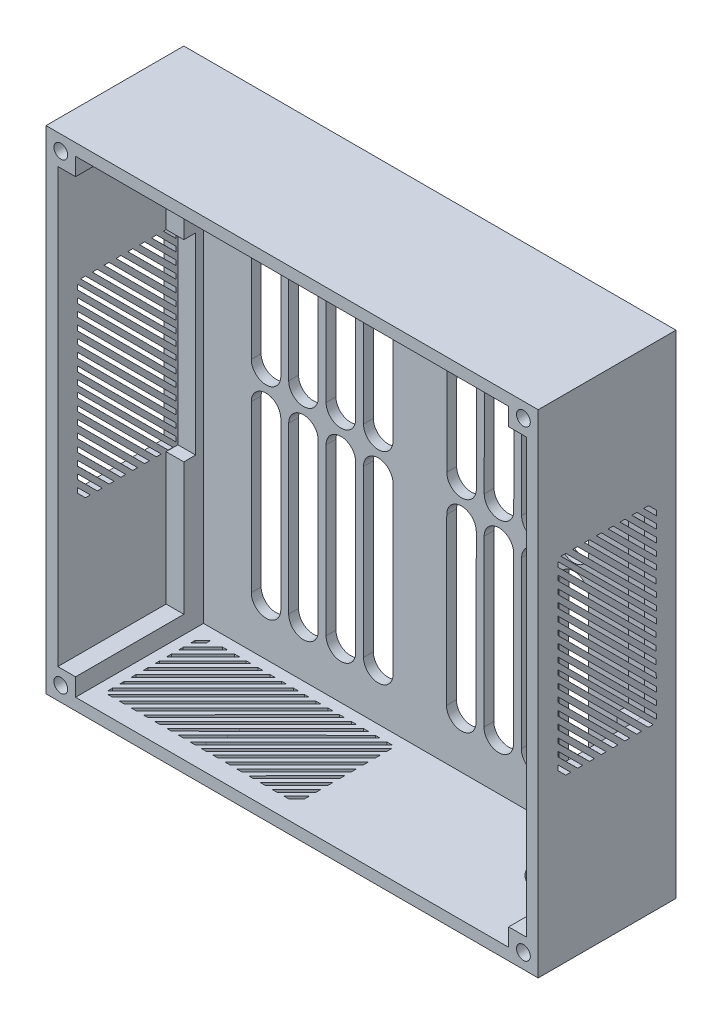
from build123d import *

# Parameters (mm, degrees)
ESBO_O1_W                = 250
ESBO_O1_H                = 250
RESSALTO_EXTRUS_O1_DEPTH = 70
ESBO_O2_W                = 238
ESBO_O2_H                = 238
CORTE_EXTRUS_O1_DEPTH    = 55
CORTE_EXTRUS_O2_DEPTH    = 340.168183978
ESBO_O7_W                = 220
ESBO_O7_H                = 229
CORTE_EXTRUS_O3_DEPTH    = 10
CORTE_EXTRUS_O4_DEPTH    = 284
CORTE_EXTRUS_O5_DEPTH    = 6
ESBO_O10_W               = 9
ESBO_O10_H               = 9
RESSALTO_EXTRUS_O2_DEPTH = 55
ESBO_O11_R               = 3.5
CORTE_EXTRUS_O6_DEPTH    = 25
ESBO_O12_R               = 13.5
CORTE_EXTRUS_O7_DEPTH    = 10


with BuildPart() as part:
    # Esboço1 → Ressalto-extrusão1 (new body)
    with BuildSketch(Plane.XY):
        with Locations((108.430425713, 114.833887043)):
            Rectangle(ESBO_O1_W, ESBO_O1_H)
    extrude(amount=RESSALTO_EXTRUS_O1_DEPTH)

    # Esboço2 → Corte-extrusão1 (cut)
    with BuildSketch(Plane.XY.offset(70)):
        with Locations((108.430425713, 114.833887043)):
            Rectangle(ESBO_O2_W, ESBO_O2_H)
    extrude(amount=-CORTE_EXTRUS_O1_DEPTH, mode=Mode.SUBTRACT)

    # Esboço6 → Corte-extrusão2 (cut, through all)
    with BuildSketch(Plane.XY.offset(15)):
        with BuildLine():
            Line((22.695507498, 208.167609342), (22.695507498, 124.153986831))
            ThreePointArc((22.695507498, 124.153986831), (30.195507498, 116.653986831), (37.695507498, 124.153986831))
            Line((37.695507498, 124.153986831), (37.695507498, 208.167609342))
            ThreePointArc((37.695507498, 208.167609342), (30.195507498, 215.667609342), (22.695507498, 208.167609342))
        make_face()
        with BuildLine():
            Line((41.695507498, 208.167609342), (41.695507498, 124.153986831))
            ThreePointArc((41.695507498, 124.153986831), (49.195507498, 116.653986831), (56.695507498, 124.153986831))
            Line((56.695507498, 124.153986831), (56.695507498, 208.167609342))
            ThreePointArc((56.695507498, 208.167609342), (49.195507498, 215.667609342), (41.695507498, 208.167609342))
        make_face()
        with BuildLine():
            Line((60.695507498, 208.167609342), (60.695507498, 124.153986831))
            ThreePointArc((60.695507498, 124.153986831), (68.195507498, 116.653986831), (75.695507498, 124.153986831))
            Line((75.695507498, 124.153986831), (75.695507498, 208.167609342))
            ThreePointArc((75.695507498, 208.167609342), (68.195507498, 215.667609342), (60.695507498, 208.167609342))
        make_face()
        with BuildLine():
            Line((79.695507498, 208.167609342), (79.695507498, 124.153986831))
            ThreePointArc((79.695507498, 124.153986831), (87.195507498, 116.653986831), (94.695507498, 124.153986831))
            Line((94.695507498, 124.153986831), (94.695507498, 208.167609342))
            ThreePointArc((94.695507498, 208.167609342), (87.195507498, 215.667609342), (79.695507498, 208.167609342))
        make_face()
        with BuildLine():
            Line((94.695507498, 105.513787255), (94.695507498, 21.500164744))
            ThreePointArc((94.695507498, 21.500164744), (87.195507498, 14.000164744), (79.695507498, 21.500164744))
            Line((79.695507498, 21.500164744), (79.695507498, 105.513787255))
            ThreePointArc((79.695507498, 105.513787255), (87.195507498, 113.013787255), (94.695507498, 105.513787255))
        make_face()
        with BuildLine():
            Line((75.695507498, 105.513787255), (75.695507498, 21.500164744))
            ThreePointArc((75.695507498, 21.500164744), (68.195507498, 14.000164744), (60.695507498, 21.500164744))
            Line((60.695507498, 21.500164744), (60.695507498, 105.513787255))
            ThreePointArc((60.695507498, 105.513787255), (68.195507498, 113.013787255), (75.695507498, 105.513787255))
        make_face()
        with BuildLine():
            Line((56.695507498, 105.513787256), (56.695507498, 21.500164744))
            ThreePointArc((56.695507498, 21.500164744), (49.195507498, 14.000164744), (41.695507498, 21.500164744))
            Line((41.695507498, 21.500164744), (41.695507498, 105.513787256))
            ThreePointArc((41.695507498, 105.513787256), (49.195507498, 113.013787256), (56.695507498, 105.513787256))
        make_face()
        with BuildLine():
            Line((37.695507498, 21.500164744), (37.695507498, 105.513787256))
            ThreePointArc((37.695507498, 105.513787256), (30.195507498, 113.013787256), (22.695507498, 105.513787256))
            Line((22.695507498, 105.513787256), (22.695507498, 21.500164744))
            ThreePointArc((22.695507498, 21.500164744), (30.195507498, 14.000164744), (37.695507498, 21.500164744))
        make_face()
        with BuildLine():
            Line((193.875104062, 21.383203899), (193.989910965, 105.396747967))
            ThreePointArc((193.989910965, 105.396747967), (186.500166922, 112.906989919), (178.989924971, 105.417245876))
            Line((178.989924971, 105.417245876), (178.875118068, 21.403701808))
            ThreePointArc((178.875118068, 21.403701808), (186.36486211, 13.893459856), (193.875104062, 21.383203899))
        make_face()
        with BuildLine():
            Line((174.875121802, 21.409167917), (174.989928706, 105.422711985))
            ThreePointArc((174.989928706, 105.422711985), (167.500184663, 112.932953936), (159.989942711, 105.443209893))
            Line((159.989942711, 105.443209893), (159.875135808, 21.429665825))
            ThreePointArc((159.875135808, 21.429665825), (167.364879851, 13.919423874), (174.875121802, 21.409167917))
        make_face()
        with BuildLine():
            Line((155.875139543, 21.435131934), (155.989946446, 105.448676002))
            ThreePointArc((155.989946446, 105.448676002), (148.500202403, 112.958917953), (140.989960451, 105.46917391))
            Line((140.989960451, 105.46917391), (140.875153548, 21.455629843))
            ThreePointArc((140.875153548, 21.455629843), (148.364897591, 13.945387891), (155.875139543, 21.435131934))
        make_face()
        with BuildLine():
            Line((136.875157283, 21.461095951), (136.989964186, 105.474640019))
            ThreePointArc((136.989964186, 105.474640019), (129.500220143, 112.984881971), (121.989978192, 105.495137928))
            Line((121.989978192, 105.495137928), (121.875171288, 21.48159386))
            ThreePointArc((121.875171288, 21.48159386), (129.364915331, 13.971351908), (136.875157283, 21.461095951))
        make_face()
        with BuildLine():
            Line((122.015450532, 124.135320099), (122.130257436, 208.148864167))
            ThreePointArc((122.130257436, 208.148864167), (129.640499387, 215.63860821), (137.13024343, 208.128366259))
            Line((137.13024343, 208.128366259), (137.015436527, 124.114822191))
            ThreePointArc((137.015436527, 124.114822191), (129.505194575, 116.625078148), (122.015450532, 124.135320099))
        make_face()
        with BuildLine():
            Line((141.015432792, 124.109356082), (141.130239695, 208.122900149))
            ThreePointArc((141.130239695, 208.122900149), (148.640481647, 215.612644192), (156.13022569, 208.102402241))
            Line((156.13022569, 208.102402241), (156.015418786, 124.088858173))
            ThreePointArc((156.015418786, 124.088858173), (148.505176835, 116.59911413), (141.015432792, 124.109356082))
        make_face()
        with BuildLine():
            Line((160.015415052, 124.083392064), (160.130221955, 208.096936132))
            ThreePointArc((160.130221955, 208.096936132), (167.640463907, 215.586680175), (175.13020795, 208.076438223))
            Line((175.13020795, 208.076438223), (175.015401046, 124.062894155))
            ThreePointArc((175.015401046, 124.062894155), (167.505159095, 116.573150112), (160.015415052, 124.083392064))
        make_face()
        with BuildLine():
            Line((179.130204215, 208.070972114), (179.015397311, 124.057428046))
            ThreePointArc((179.015397311, 124.057428046), (186.505141354, 116.547186095), (194.015383306, 124.036930138))
            Line((194.015383306, 124.036930138), (194.130190209, 208.050474206))
            ThreePointArc((194.130190209, 208.050474206), (186.640446166, 215.560716157), (179.130204215, 208.070972114))
        make_face()
    extrude(amount=-CORTE_EXTRUS_O2_DEPTH, mode=Mode.SUBTRACT)

    # Esboço7 → Corte-extrusão3 (cut)
    with BuildSketch(Plane.XY.offset(15)):
        with Locations((108.430425713, 110.333887043)):
            Rectangle(ESBO_O7_W, ESBO_O7_H)
    extrude(amount=-CORTE_EXTRUS_O3_DEPTH, mode=Mode.SUBTRACT)

    # Esboço8 → Corte-extrusão4 (cut)
    with BuildSketch(Plane.ZY.offset(16.569574287)):
        Polygon((10, 165.657391929), (13.961640311, 169.619032239), (16.461640311, 169.619032239), (10, 163.157391929), align=None)
        Polygon((9.956696651, 159.702229933), (19.862081873, 169.619032239), (22.461640311, 169.619032239), (9.958136588, 157.202230348), align=None)
        Polygon((9.966328348, 153.687514394), (25.894980213, 169.619032239), (28.461640311, 169.619032239), (9.966553235, 151.187514404), align=None)
        Polygon((9.968480298, 147.691590035), (31.898716024, 169.619032239), (34.461640311, 169.619032239), (9.96832106, 145.19159004), align=None)
        Polygon((9.969979722, 141.689354591), (37.916440288, 169.619032239), (40.461640311, 169.619032239), (9.969228824, 139.189354704), align=None)
        Polygon((10.043084045, 135.657583442), (43.961640311, 169.619032239), (46.504532842, 169.619032239), (10.043084045, 133.157583442), align=None)
        Polygon((10.000315774, 129.657707703), (50.008285442, 169.619032239), (52.511524518, 169.619032239), (10.000315774, 127.157707703), align=None)
        Polygon((9.975901213, 123.689230729), (55.961640311, 169.619032239), (58.461640311, 169.619032239), (9.974420071, 121.189231168), align=None)
        Polygon((60.01635331, 168.062475947), (60.013391026, 165.562477702), (14.029132631, 119.629929589), (10, 115.605352624), (10, 118.105352624), (11.52913307, 119.632674875), align=None)
        Polygon((60.009302937, 162.112364331), (60.006336815, 159.609127013), (22.55626101, 122.084448938), (10.040407278, 109.546632677), (10.043104787, 112.046631221), (20.063650654, 122.087138476), align=None)
        Polygon((60.002185171, 156.105376873), (59.999172063, 153.562486126), (28.495336324, 122.078040649), (10.033931215, 103.544745925), (10.036628725, 106.04474447), (25.95663356, 122.08077992), align=None)
        Polygon((59.995024865, 150.062488583), (59.992009023, 147.517290347), (34.535969381, 122.071522778), (10.027487599, 97.57293071), (10.030152907, 100.043085143), (31.998054458, 122.0742612), align=None)
        Polygon((59.987915383, 144.062492795), (59.98487854, 141.499570308), (40.533783745, 122.06505111), (10.021019354, 91.578288714), (10.023677595, 94.041893995), (38.003614648, 122.067781174), align=None)
        Polygon((59.980805902, 138.062497008), (59.977764631, 135.495838711), (46.52552807, 122.058585991), (10.014556109, 85.588281957), (10.017208432, 88.046402315), (44.00304904, 122.061307757), align=None)
        Polygon((59.97369642, 132.06250122), (59.970616168, 129.462944607), (52.545171852, 122.052090768), (10.00809321, 79.598594503), (10.010743612, 82.054935218), (50.030538903, 122.054804068), align=None)
        Polygon((59.966586939, 126.062505432), (59.963624655, 123.562507187), (58.445204576, 122.045724606), (10.001679442, 73.654442054), (10.001345045, 76.089831774), (55.937605465, 122.048430317), align=None)
        Polygon((11.556474866, 72.097968094), (13.991862808, 72.095005901), (60, 117.981650075), (60, 120.489250646), align=None)
        Polygon((17.500630776, 72.097968094), (19.956972921, 72.097968094), (60, 112.074580075), (60, 114.589214487), align=None)
        Polygon((23.490321716, 72.097968094), (25.948443505, 72.097968094), (60, 106.047086703), (60, 108.569567201), align=None)
        Polygon((29.48033196, 72.097968094), (31.943938675, 72.097968094), (60, 100.047648818), (60, 102.577819388), align=None)
        Polygon((35.474977446, 72.097968094), (37.945133316, 72.097968094), (60, 94.042085133), (60, 96.580001532), align=None)
        Polygon((41.446796137, 72.097968094), (43.946796137, 72.097968094), (60, 88.000660717), (60, 90.53936496), align=None)
        Polygon((47.448686383, 72.097968094), (49.948686383, 72.097968094), (60, 82.107674381), (60, 84.600286188), align=None)
        Polygon((53.491575983, 72.097968094), (55.991575983, 72.097968094), (60, 76.089799272), (60.010391746, 78.589799272), align=None)
    extrude(amount=-CORTE_EXTRUS_O4_DEPTH, mode=Mode.SUBTRACT)

    # Esboço9 → Corte-extrusão5 (cut)
    with BuildSketch(Plane.XY.offset(15)):
        Polygon((-10.569574287, 169.619032239), (-1.569574287, 169.619032239), (-1.569574287, 73.100480919), (-1.569574287, 71.883016902), (-10.569574287, 71.883016902), align=None)
        Polygon((218.430425713, 73.100480919), (218.430425713, 169.619032239), (227.430425713, 169.619032239), (227.430425713, 71.883016902), (218.430425713, 71.883016902), align=None)
    extrude(amount=-CORTE_EXTRUS_O5_DEPTH, mode=Mode.SUBTRACT)

    # Esboço10 → Ressalto-extrusão2 (add)
    with BuildSketch(Plane.XY.offset(15)):
        with Locations((-6.069574287, 229.333887043)):
            Rectangle(ESBO_O10_W, ESBO_O10_H)
        with Locations((222.930425713, 229.333887043)):
            Rectangle(ESBO_O10_W, ESBO_O10_H)
        with Locations((222.930425713, 0.333887043)):
            Rectangle(ESBO_O10_W, ESBO_O10_H)
        with Locations((-6.069574287, 0.333887043)):
            Rectangle(ESBO_O10_W, ESBO_O10_H)
    extrude(amount=RESSALTO_EXTRUS_O2_DEPTH)

    # Esboço11 → Corte-extrusão6 (cut)
    with BuildSketch(Plane.XY.offset(70)):
        with Locations((-9.069574287, 232.333887043)):
            Circle(ESBO_O11_R)
        with Locations((225.930425713, 232.333887043)):
            Circle(ESBO_O11_R)
        with Locations((-9.069574287, -2.666112957)):
            Circle(ESBO_O11_R)
        with Locations((225.930425713, -2.666112957)):
            Circle(ESBO_O11_R)
    extrude(amount=-CORTE_EXTRUS_O6_DEPTH, mode=Mode.SUBTRACT)

    # Esboço12 → Corte-extrusão7 (cut)
    with BuildSketch(Plane.XZ.offset(10.166112957)):
        with Locations((200.485605127, 24.656721414)):
            Circle(ESBO_O12_R)
        Polygon((97.339878372, 60.59143644), (101.301518682, 56.629796129), (101.301518682, 54.129796129), (94.839878372, 60.59143644), align=None)
        Polygon((91.384716376, 60.634739789), (101.301518682, 50.729354567), (101.301518682, 48.129796129), (88.884716791, 60.633299852), align=None)
        Polygon((85.370000837, 60.625108093), (101.301518682, 44.696456227), (101.301518682, 42.129796129), (82.870000847, 60.624883205), align=None)
        Polygon((79.374076478, 60.622956142), (101.301518682, 38.692720416), (101.301518682, 36.129796129), (76.874076483, 60.62311538), align=None)
        Polygon((73.371841034, 60.621456718), (101.301518682, 32.674996153), (101.301518682, 30.129796129), (70.871841147, 60.622207616), align=None)
        Polygon((67.340069885, 60.548352395), (101.301518682, 26.629796129), (101.301518682, 24.086903598), (64.840069885, 60.548352395), align=None)
        Polygon((61.340194146, 60.591120666), (101.301518682, 20.583150998), (101.301518682, 18.079911922), (58.840194146, 60.591120666), align=None)
        Polygon((55.371717172, 60.615535227), (101.301518682, 14.629796129), (101.301518682, 12.129796129), (52.871717611, 60.617016369), align=None)
        Polygon((99.74496239, 10.57508313), (97.244964145, 10.578045414), (51.312416026, 56.562303815), (47.287839067, 60.59143644), (49.787839067, 60.59143644), (51.315161318, 59.06230337), align=None)
        Polygon((93.794850774, 10.582133504), (91.291613456, 10.585099626), (53.766935386, 48.035175425), (41.22911912, 60.551029163), (43.729117664, 60.548331653), (53.769624924, 50.527785781), align=None)
        Polygon((87.787863316, 10.58925127), (85.244972569, 10.592264378), (53.760527092, 42.096100116), (35.227232368, 60.557505225), (37.727230913, 60.554807716), (53.763266363, 44.634802881), align=None)
        Polygon((81.744975026, 10.596411575), (79.19977679, 10.599427417), (53.754009221, 36.05546706), (29.255417153, 60.563948841), (31.725571586, 60.561283533), (53.756747643, 38.593381982), align=None)
        Polygon((75.744979238, 10.603521057), (73.182056751, 10.606557901), (53.747537553, 30.057652696), (23.260775157, 60.570417087), (25.724380438, 60.567758845), (53.750267617, 32.587821792), align=None)
        Polygon((69.74498345, 10.610630538), (67.178325154, 10.613671809), (53.741072434, 24.06590837), (17.2707684, 60.576880331), (19.728888758, 60.574228008), (53.7437942, 26.5883874), align=None)
        Polygon((63.744987663, 10.61774002), (61.14543105, 10.620820272), (53.734577211, 18.046264588), (11.281080946, 60.583343231), (13.737421661, 60.580692828), (53.737290511, 20.560897537), align=None)
        Polygon((57.744991875, 10.624849501), (55.24499363, 10.627811785), (53.728211049, 12.146231864), (5.336928497, 60.589756998), (7.772318217, 60.590091396), (53.73091676, 14.653830975), align=None)
        Polygon((3.780454537, 59.034961574), (3.777492344, 56.599573632), (49.664136518, 10.59143644), (52.171737089, 10.59143644), align=None)
        Polygon((3.780454537, 53.090805665), (3.780454537, 50.634463519), (43.757066518, 10.59143644), (46.27170093, 10.59143644), align=None)
        Polygon((3.780454537, 47.101114724), (3.780454537, 44.642992935), (37.729573146, 10.59143644), (40.252053644, 10.59143644), align=None)
        Polygon((3.780454537, 41.11110448), (3.780454537, 38.647497765), (31.730135261, 10.59143644), (34.260305831, 10.59143644), align=None)
        Polygon((3.780454537, 35.116458994), (3.780454537, 32.646303124), (25.724571576, 10.59143644), (28.262487975, 10.59143644), align=None)
        Polygon((3.780454537, 29.144640303), (3.780454537, 26.644640303), (19.68314716, 10.59143644), (22.221851403, 10.59143644), align=None)
        Polygon((3.780454537, 23.142750057), (3.780454537, 20.642750057), (13.790160829, 10.591436435), (16.282772636, 10.591436435), align=None)
        Polygon((3.780454537, 17.099860457), (3.780454537, 14.599860457), (7.772285715, 10.59143644), (7.772285715, 13.09143644), align=None)
    extrude(amount=-CORTE_EXTRUS_O7_DEPTH, mode=Mode.SUBTRACT)


solid = part.part
